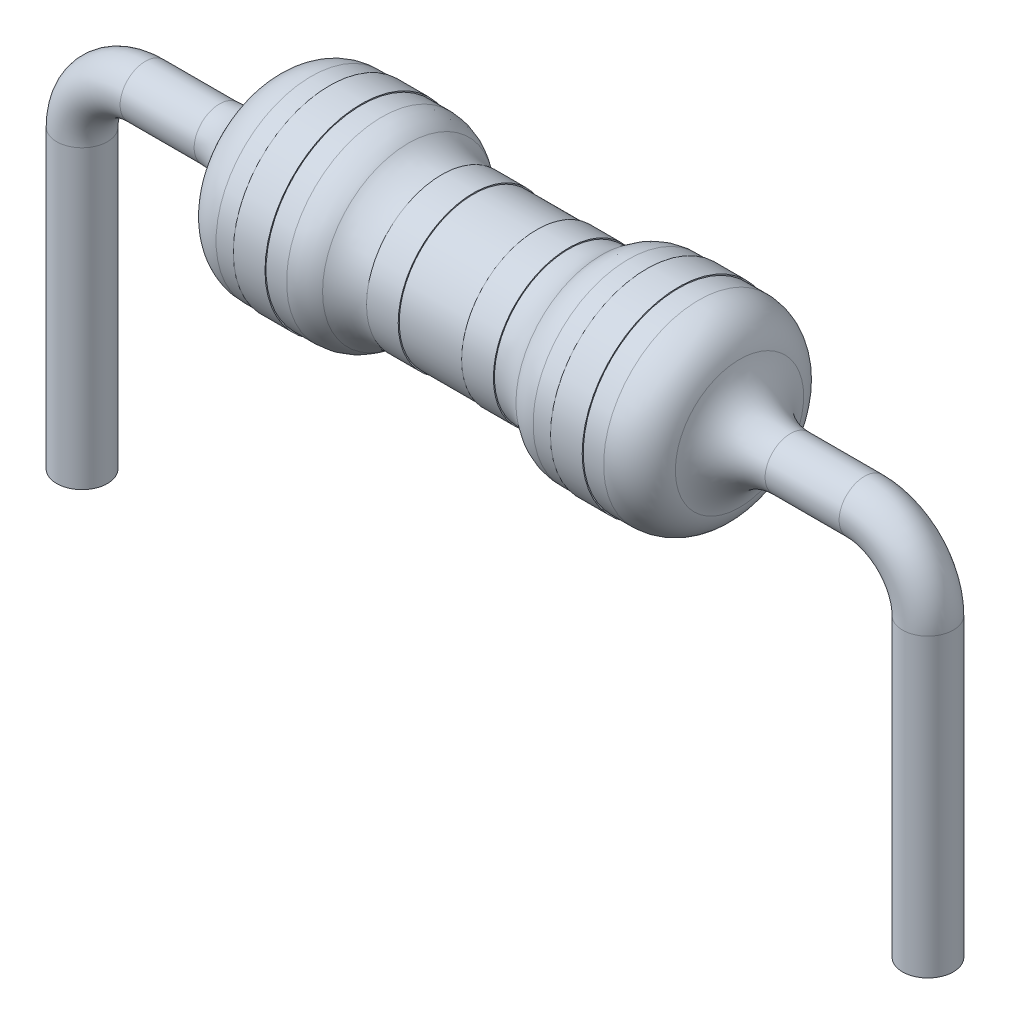
from build123d import *

# Parameters (mm, degrees)
SKETCH3_R           = 0.3048
FILLET5_R           = 0.635
FILLET6_R           = 0.508
SKETCH5_R           = 1.1557
SKETCH5_R_2         = 1.143
EXTRUDE_THIN1_DEPTH = 0.381
SKETCH6_R           = 0.9017
SKETCH6_R_2         = 0.889
EXTRUDE_THIN2_DEPTH = 0.381
SKETCH7_R           = 0.9017
SKETCH7_R_2         = 0.889
EXTRUDE_THIN3_DEPTH = 0.381
SKETCH8_R           = 1.1557
SKETCH8_R_2         = 1.143
EXTRUDE_THIN4_DEPTH = 0.381


with BuildPart() as part:
    # Base-Sweep: sweep along a path in Sketch1
    with BuildLine(Plane.XY) as base_sweep_path:
        Line((0, -2.54), (0, 1.016))
        ThreePointArc((0, 1.016), (0.223184633, 1.554815367), (0.762, 1.778))
        Line((0.762, 1.778), (9.398, 1.778))
        ThreePointArc((9.398, 1.778), (9.936815367, 1.554815367), (10.16, 1.016))
        Line((10.16, 1.016), (10.16, -2.54))
    # Sketch3 → Base-Sweep (sweep)
    with BuildSketch(Plane(origin=(0, -2.54, 0), x_dir=(-1, 0, 0), z_dir=(0, 1, 0))):
        Circle(SKETCH3_R)
    sweep(path=base_sweep_path.line)

    # Sketch4 → Revolve1 (revolve)
    with BuildSketch(Plane.XY, mode=Mode.PRIVATE) as revolve1_sk:
        Polygon((2.286, 2.921), (2.286, 2.0828), (7.874, 2.0828), (7.874, 2.921), (6.35, 2.921), (6.35, 2.667), (3.81, 2.667), (3.81, 2.921), align=None)
    revolve(revolve1_sk.sketch.rotate(Axis((-3.216958819, 1.778, 0), (1, 0, 0)), 90), axis=Axis((-3.216958819, 1.778, 0), (1, 0, 0)))

    # Fillet5
    # the kernel refuses this fillet: 0.635 mm, written as the material it adds along each edge
    with BuildSketch(Plane(origin=(2.286, 1.778, 0), x_dir=(0, 1, 0), z_dir=(0, 0, 1))) as fillet5_piece_1:
        with BuildLine():
            CenterArc((0.3048 + FILLET5_R, FILLET5_R), FILLET5_R, 180, 90)
            Line((0.3048 + FILLET5_R, 0), (0.3048 + FILLET5_R, -FILLET5_R * 0.02))
            Line((0.3048 + FILLET5_R, -FILLET5_R * 0.02), (0.3048 - FILLET5_R * 0.02, -FILLET5_R * 0.02))
            Line((0.3048 - FILLET5_R * 0.02, -FILLET5_R * 0.02), (0.3048 - FILLET5_R * 0.02, FILLET5_R))
            Line((0.3048 - FILLET5_R * 0.02, FILLET5_R), (0.3048, FILLET5_R))
        make_face()
    revolve(axis=Axis((2.286, 1.778, 0), (-1, 0, 0)))
    with BuildSketch(Plane(origin=(7.874, 1.778, 0), x_dir=(0, 1, 0), z_dir=(0, 0, 1))) as fillet5_piece_2:
        with BuildLine():
            CenterArc((0.3048 + FILLET5_R, -FILLET5_R), FILLET5_R, 90, 90)
            Line((0.3048, -FILLET5_R), (0.3048 - FILLET5_R * 0.02, -FILLET5_R))
            Line((0.3048 - FILLET5_R * 0.02, -FILLET5_R), (0.3048 - FILLET5_R * 0.02, FILLET5_R * 0.02))
            Line((0.3048 - FILLET5_R * 0.02, FILLET5_R * 0.02), (0.3048 + FILLET5_R, FILLET5_R * 0.02))
            Line((0.3048 + FILLET5_R, FILLET5_R * 0.02), (0.3048 + FILLET5_R, 0))
        make_face()
    revolve(axis=Axis((7.874, 1.778, 0), (-1, 0, 0)))
    with BuildSketch(Plane(origin=(6.35, 1.778, 0), x_dir=(0, 0, 1), z_dir=(0, 1, 0))) as fillet5_piece_3:
        with BuildLine():
            CenterArc((1.524, -0.508), FILLET5_R, 126.869897645, 53.130102355)
            Line((1.143, 0), (1.13538, 0.01016))
            ThreePointArc((1.13538, 0.01016), (1.016, 0.0127), (0.889, 0.0127))
            Line((0.889, 0.0127), (0.8763, 0))
            Line((0.8763, 0), (0.8763, -0.508))
            Line((0.8763, -0.508), (0.889, -0.508))
        make_face()
    revolve(axis=Axis((6.35, 1.778, 0), (1, 0, 0)))
    with BuildSketch(Plane(origin=(3.81, 1.778, 0), x_dir=(0, 0, 1), z_dir=(0, 1, 0))) as fillet5_piece_4:
        with BuildLine():
            CenterArc((1.524, 0.508), FILLET5_R, 180, 53.130102355)
            Line((0.889, 0.508), (0.8763, 0.508))
            Line((0.8763, 0.508), (0.8763, 0))
            Line((0.8763, 0), (0.889, -0.0127))
            ThreePointArc((0.889, -0.0127), (1.016, -0.0127), (1.13538, -0.01016))
            Line((1.13538, -0.01016), (1.143, 0))
        make_face()
    revolve(axis=Axis((3.81, 1.778, 0), (1, 0, 0)))

    # Fillet6
    fillet6_edges = [part.edges().sort_by_distance(p)[0] for p in [
        (7.874, 1.778, -1.143),
        (6.35, 1.778, -1.143),
        (3.81, 1.778, -1.143),
        (2.286, 1.778, -1.143),
    ]]
    fillet(fillet6_edges, radius=FILLET6_R)

    # Sketch5 → Extrude-Thin1 (add)
    with BuildSketch(Plane(origin=(2.9718, 0, 0), x_dir=(0, 0, -1), z_dir=(1, 0, 0))):
        with Locations((0, 1.778)):
            Circle(SKETCH5_R)
        with Locations((0, 1.778)):
            Circle(SKETCH5_R_2, mode=Mode.SUBTRACT)
    extrude(amount=EXTRUDE_THIN1_DEPTH)

    # Sketch6 → Extrude-Thin2 (add)
    with BuildSketch(Plane(origin=(4.318, 0, 0), x_dir=(0, 0, -1), z_dir=(1, 0, 0))):
        with Locations((0, 1.778)):
            Circle(SKETCH6_R)
        with Locations((0, 1.778)):
            Circle(SKETCH6_R_2, mode=Mode.SUBTRACT)
    extrude(amount=EXTRUDE_THIN2_DEPTH)

    # Sketch7 → Extrude-Thin3 (add)
    with BuildSketch(Plane(origin=(5.461, 0, 0), x_dir=(0, 0, -1), z_dir=(1, 0, 0))):
        with Locations((0, 1.778)):
            Circle(SKETCH7_R)
        with Locations((0, 1.778)):
            Circle(SKETCH7_R_2, mode=Mode.SUBTRACT)
    extrude(amount=EXTRUDE_THIN3_DEPTH)

    # Sketch8 → Extrude-Thin4 (add)
    with BuildSketch(Plane(origin=(6.7818, 0, 0), x_dir=(0, 0, -1), z_dir=(1, 0, 0))):
        with Locations((0, 1.778)):
            Circle(SKETCH8_R)
        with Locations((0, 1.778)):
            Circle(SKETCH8_R_2, mode=Mode.SUBTRACT)
    extrude(amount=EXTRUDE_THIN4_DEPTH)


solid = part.part
